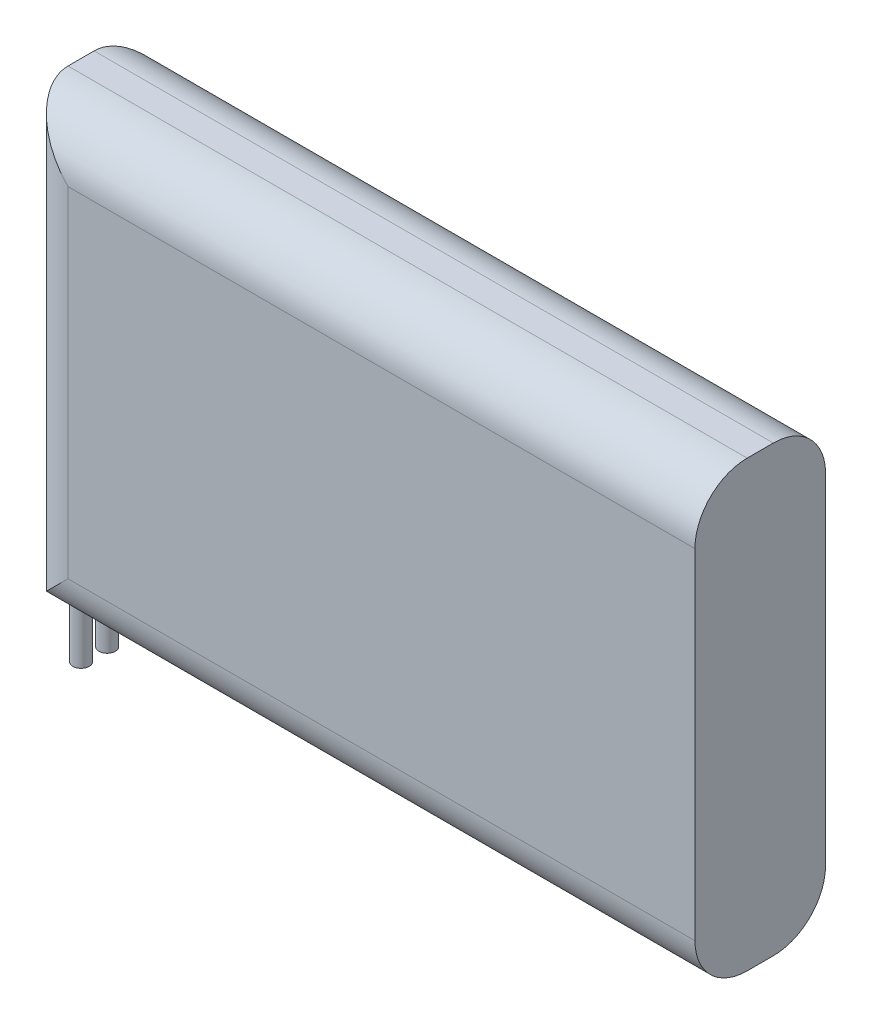
from build123d import *

# Parameters (mm, degrees)
SKETCH1_W           = 52
SKETCH1_H           = 34
BOSS_EXTRUDE1_DEPTH = 5
SKETCH2_R           = 0.625
BOSS_EXTRUDE2_DEPTH = 5
FILLET1_R           = 4


with BuildPart() as part:
    # Sketch1 → Boss-Extrude1 (new, symmetric)
    with BuildSketch(Plane.XY):
        Rectangle(SKETCH1_W, SKETCH1_H)
    extrude(amount=BOSS_EXTRUDE1_DEPTH, both=True)

    # Sketch2 → Boss-Extrude2 (add)
    with BuildSketch(Plane.XZ.offset(17)):
        with Locations(Location((-25, 1, 0), (0, 0, 90))):
            Circle(SKETCH2_R)
        with Locations(Location((-25, -1, 0), (0, 0, 90))):
            Circle(SKETCH2_R)
    extrude(amount=BOSS_EXTRUDE2_DEPTH)

    # Fillet1
    # the kernel refuses this fillet: 4 mm, written as the material it takes off along each edge
    with BuildSketch(Plane(origin=(-26, 27, 5), x_dir=(0, 0, -1), z_dir=(0, -1, 0)), Plane(origin=(-26, 27, -5), x_dir=(1, 0, 0), z_dir=(0, -1, 0))) as fillet1_piece_1:
        with BuildLine():
            CenterArc((FILLET1_R, FILLET1_R), FILLET1_R, 180, 90)
            Line((0, FILLET1_R), (0, 0))
            Line((0, 0), (FILLET1_R, 0))
        make_face()
    extrude(amount=54, mode=Mode.SUBTRACT)
    with BuildSketch(Plane(origin=(-36, -17, 5), x_dir=(0, 0, -1), z_dir=(1, 0, 0))) as fillet1_piece_2_section:
        with BuildLine():
            CenterArc((FILLET1_R, FILLET1_R), FILLET1_R, 180, 90)
            Line((0, FILLET1_R), (0, 0))
            Line((0, 0), (FILLET1_R, 0))
        make_face()
    fillet1_piece_2 = extrude(amount=72, mode=Mode.PRIVATE)
    fillet1_piece_2 = fillet1_piece_2 - Plane(origin=(-25, -16.094238655, 1), x_dir=(0, 0, 1), z_dir=(0, 1, 0)) * Cylinder(0.625, 160, mode=Mode.PRIVATE)
    add(fillet1_piece_2, mode=Mode.SUBTRACT)
    with BuildSketch(Plane(origin=(-36, -17, -5), x_dir=(0, 0, 1), z_dir=(1, 0, 0))) as fillet1_piece_3_section:
        with BuildLine():
            CenterArc((FILLET1_R, -FILLET1_R), FILLET1_R, 90, 90)
            Line((0, -FILLET1_R), (0, 0))
            Line((0, 0), (FILLET1_R, 0))
        make_face()
    fillet1_piece_3 = extrude(amount=72, mode=Mode.PRIVATE)
    fillet1_piece_3 = fillet1_piece_3 - Plane(origin=(-25, -16.094238658, -1), x_dir=(0, 0, 1), z_dir=(0, 1, 0)) * Cylinder(0.625, 160, mode=Mode.PRIVATE)
    add(fillet1_piece_3, mode=Mode.SUBTRACT)
    with BuildSketch(Plane(origin=(36, 17, -5), x_dir=(0, -1, 0), z_dir=(-1, 0, 0))) as fillet1_piece_4:
        with BuildLine():
            CenterArc((FILLET1_R, FILLET1_R), FILLET1_R, 180, 90)
            Line((0, FILLET1_R), (0, 0))
            Line((0, 0), (FILLET1_R, 0))
        make_face()
    extrude(amount=72, mode=Mode.SUBTRACT)
    with BuildSketch(Plane(origin=(36, 17, 5), x_dir=(0, -1, 0), z_dir=(-1, 0, 0))) as fillet1_piece_5:
        with BuildLine():
            CenterArc((FILLET1_R, -FILLET1_R), FILLET1_R, 90, 90)
            Line((0, -FILLET1_R), (0, 0))
            Line((0, 0), (FILLET1_R, 0))
        make_face()
    extrude(amount=72, mode=Mode.SUBTRACT)


solid = part.part
